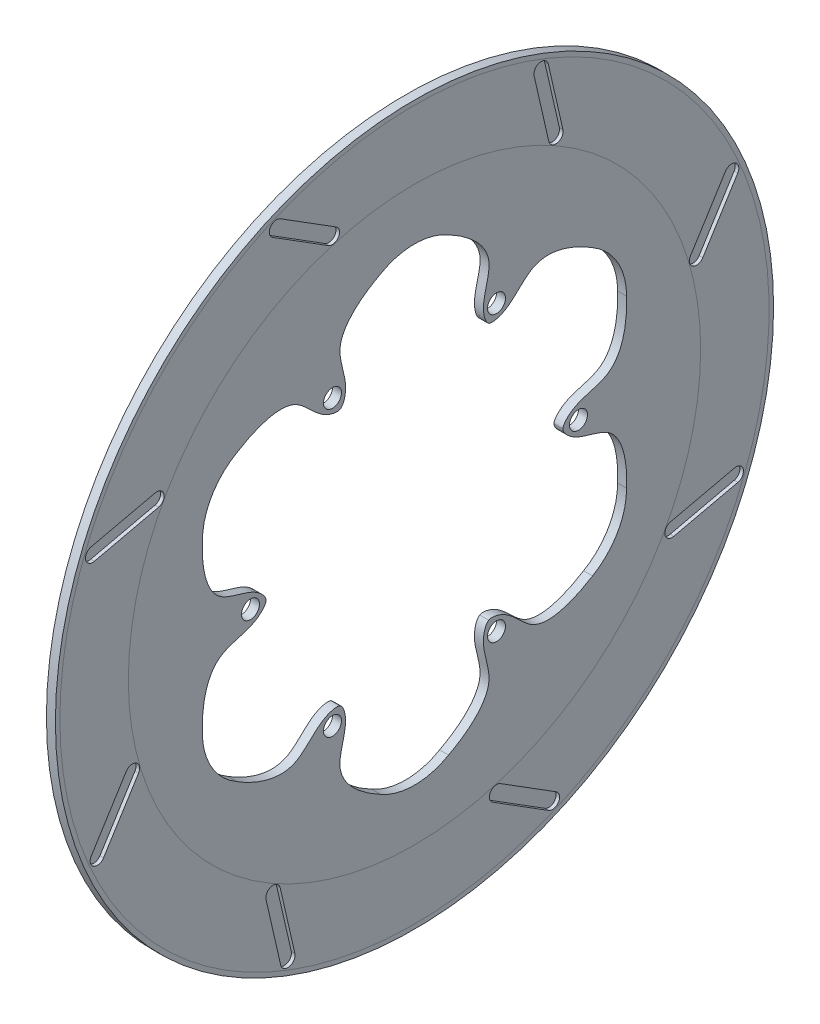
from build123d import *

# Parameters (mm, degrees)
SKETCH1_R                = 127
SKETCH1_R_2              = 3.175
SKETCH1_R_3              = 52.5
BOSS_EXTRUDE1_DEPTH      = 3.175
CUT_EXTRUDE7_DEPTH       = 1.27
CUT_EXTRUDE9_DEPTH       = 1.27
SKETCH31_RX              = 23.014926529
SKETCH31_RY              = 21.216885394
CUT_EXTRUDE10_DEPTH      = 205.994
CUT_EXTRUDE11_DEPTH      = 121.92
CUT_EXTRUDE11_DEPTH_BACK = 7.112
CUT_EXTRUDE13_START      = -3.175
CUT_EXTRUDE13_DEPTH      = 3.175


# Read off the part's stored shape, not the designer's step: Cut-Extrude13
with BuildPart() as part:
    # Sketch1 → Boss-Extrude1 (new body)
    with BuildSketch(Plane.ZY):
        Circle(SKETCH1_R)
        with Locations((29, 50.229473419)):
            Circle(SKETCH1_R_2, mode=Mode.SUBTRACT)
        with Locations((-58, 0)):
            Circle(SKETCH1_R_2, mode=Mode.SUBTRACT)
        with Locations((58, 0)):
            Circle(SKETCH1_R_2, mode=Mode.SUBTRACT)
        with Locations((-29, -50.229473419)):
            Circle(SKETCH1_R_2, mode=Mode.SUBTRACT)
        with Locations((29, -50.229473419)):
            Circle(SKETCH1_R_2, mode=Mode.SUBTRACT)
        with Locations((-29, 50.229473419)):
            Circle(SKETCH1_R_2, mode=Mode.SUBTRACT)
        Circle(SKETCH1_R_3, mode=Mode.SUBTRACT)
    extrude(amount=BOSS_EXTRUDE1_DEPTH)

    # Sketch28 → Cut-Extrude7 (cut)
    with BuildSketch(Plane.ZY.offset(3.175)):
        with BuildLine():
            Line((68.660394365, 80.255233954), (91.914044035, 82.885177581))
            ThreePointArc((91.914044035, 82.885177581), (94.755506117, 80.621138038), (92.491466575, 77.779675956))
            Line((92.491466575, 77.779675956), (69.237816905, 75.14973233))
            ThreePointArc((69.237816905, 75.14973233), (66.396354823, 77.413771872), (68.660394365, 80.255233954))
        make_face()
        with BuildLine():
            Line((-8.1987897, 105.299250609), (6.384372696, 123.60171495))
            ThreePointArc((6.384372696, 123.60171495), (9.994507516, 124.010014344), (10.40280691, 120.399879524))
            Line((10.40280691, 120.399879524), (-4.180355487, 102.097415183))
            ThreePointArc((-4.180355487, 102.097415183), (-7.790490307, 101.689115789), (-8.1987897, 105.299250609))
        make_face()
        with BuildLine():
            Line((105.299250609, 8.1987897), (123.60171495, -6.384372696))
            ThreePointArc((123.60171495, -6.384372696), (124.010014344, -9.994507516), (120.399879524, -10.40280691))
            Line((120.399879524, -10.40280691), (102.097415183, 4.180355487))
            ThreePointArc((102.097415183, 4.180355487), (101.689115789, 7.790490307), (105.299250609, 8.1987897))
        make_face()
        with BuildLine():
            Line((80.255233954, -68.660394365), (82.885177581, -91.914044035))
            ThreePointArc((82.885177581, -91.914044035), (80.621138038, -94.755506117), (77.779675956, -92.491466575))
            Line((77.779675956, -92.491466575), (75.14973233, -69.237816905))
            ThreePointArc((75.14973233, -69.237816905), (77.413771872, -66.396354823), (80.255233954, -68.660394365))
        make_face()
        with BuildLine():
            Line((8.1987897, -105.299250609), (-6.384372696, -123.60171495))
            ThreePointArc((-6.384372696, -123.60171495), (-9.994507516, -124.010014344), (-10.40280691, -120.399879524))
            Line((-10.40280691, -120.399879524), (4.180355487, -102.097415183))
            ThreePointArc((4.180355487, -102.097415183), (7.790490307, -101.689115789), (8.1987897, -105.299250609))
        make_face()
        with BuildLine():
            Line((-68.660394365, -80.255233954), (-91.914044035, -82.885177581))
            ThreePointArc((-91.914044035, -82.885177581), (-94.755506117, -80.621138038), (-92.491466575, -77.779675956))
            Line((-92.491466575, -77.779675956), (-69.237816905, -75.14973233))
            ThreePointArc((-69.237816905, -75.14973233), (-66.396354823, -77.413771872), (-68.660394365, -80.255233954))
        make_face()
        with BuildLine():
            Line((-105.299250609, -8.1987897), (-123.60171495, 6.384372696))
            ThreePointArc((-123.60171495, 6.384372696), (-124.010014344, 9.994507516), (-120.399879524, 10.40280691))
            Line((-120.399879524, 10.40280691), (-102.097415183, -4.180355487))
            ThreePointArc((-102.097415183, -4.180355487), (-101.689115789, -7.790490307), (-105.299250609, -8.1987897))
        make_face()
        with BuildLine():
            Line((-80.255233954, 68.660394365), (-82.885177581, 91.914044035))
            ThreePointArc((-82.885177581, 91.914044035), (-80.621138038, 94.755506117), (-77.779675956, 92.491466575))
            Line((-77.779675956, 92.491466575), (-75.14973233, 69.237816905))
            ThreePointArc((-75.14973233, 69.237816905), (-77.413771872, 66.396354823), (-80.255233954, 68.660394365))
        make_face()
    extrude(amount=-CUT_EXTRUDE7_DEPTH, mode=Mode.SUBTRACT)

    # Sketch30 → Cut-Extrude9 (cut)
    with BuildSketch(Plane(origin=(0, 0, 0), x_dir=(0, 0, -1), z_dir=(1, 0, 0))):
        with BuildLine():
            Line((52.499778397, 91.665844493), (47.303844486, 114.363287974))
            ThreePointArc((47.303844486, 114.363287974), (44.232592049, 116.290324387), (42.305555635, 113.21907195))
            Line((42.305555635, 113.21907195), (47.501489546, 90.521628469))
            ThreePointArc((47.501489546, 90.521628469), (50.572741983, 88.594592056), (52.499778397, 91.665844493))
        make_face()
        with BuildLine():
            Line((101.940489559, 27.694590929), (114.315925657, 47.418187233))
            ThreePointArc((114.315925657, 47.418187233), (113.506842748, 50.952511174), (109.972518807, 50.143428264))
            Line((109.972518807, 50.143428264), (97.597082709, 30.41983196))
            ThreePointArc((97.597082709, 30.41983196), (98.406165619, 26.885508019), (101.940489559, 27.694590929))
        make_face()
        with BuildLine():
            Line((91.665844493, -52.499778397), (114.363287974, -47.303844486))
            ThreePointArc((114.363287974, -47.303844486), (116.290324387, -44.232592049), (113.21907195, -42.305555635))
            Line((113.21907195, -42.305555635), (90.521628469, -47.501489546))
            ThreePointArc((90.521628469, -47.501489546), (88.594592056, -50.572741983), (91.665844493, -52.499778397))
        make_face()
        with BuildLine():
            Line((27.694590929, -101.940489559), (47.418187233, -114.315925657))
            ThreePointArc((47.418187233, -114.315925657), (50.952511174, -113.506842748), (50.143428264, -109.972518807))
            Line((50.143428264, -109.972518807), (30.41983196, -97.597082709))
            ThreePointArc((30.41983196, -97.597082709), (26.885508019, -98.406165619), (27.694590929, -101.940489559))
        make_face()
        with BuildLine():
            Line((-52.499778397, -91.665844493), (-47.303844486, -114.363287974))
            ThreePointArc((-47.303844486, -114.363287974), (-44.232592049, -116.290324387), (-42.305555635, -113.21907195))
            Line((-42.305555635, -113.21907195), (-47.501489546, -90.521628469))
            ThreePointArc((-47.501489546, -90.521628469), (-50.572741983, -88.594592056), (-52.499778397, -91.665844493))
        make_face()
        with BuildLine():
            Line((-101.940489559, -27.694590929), (-114.315925657, -47.418187233))
            ThreePointArc((-114.315925657, -47.418187233), (-113.506842748, -50.952511174), (-109.972518807, -50.143428264))
            Line((-109.972518807, -50.143428264), (-97.597082709, -30.41983196))
            ThreePointArc((-97.597082709, -30.41983196), (-98.406165619, -26.885508019), (-101.940489559, -27.694590929))
        make_face()
        with BuildLine():
            Line((-91.665844493, 52.499778397), (-114.363287974, 47.303844486))
            ThreePointArc((-114.363287974, 47.303844486), (-116.290324387, 44.232592049), (-113.21907195, 42.305555635))
            Line((-113.21907195, 42.305555635), (-90.521628469, 47.501489546))
            ThreePointArc((-90.521628469, 47.501489546), (-88.594592056, 50.572741983), (-91.665844493, 52.499778397))
        make_face()
        with BuildLine():
            Line((-27.694590929, 101.940489559), (-47.418187233, 114.315925657))
            ThreePointArc((-47.418187233, 114.315925657), (-50.952511174, 113.506842748), (-50.143428264, 109.972518807))
            Line((-50.143428264, 109.972518807), (-30.41983196, 97.597082709))
            ThreePointArc((-30.41983196, 97.597082709), (-26.885508019, 98.406165619), (-27.694590929, 101.940489559))
        make_face()
    extrude(amount=-CUT_EXTRUDE9_DEPTH, mode=Mode.SUBTRACT)

    # Sketch31 → Cut-Extrude10 (cut)
    with BuildSketch(Plane.ZY.offset(3.175)):
        with Locations((0, 55.9190793)):
            Ellipse(SKETCH31_RX, SKETCH31_RY)
        with Locations(Location((48.42734323, 27.95953965), (0, 0, -60))):
            Ellipse(SKETCH31_RX, SKETCH31_RY)
        with Locations(Location((48.42734323, -27.95953965), (0, 0, 60))):
            Ellipse(SKETCH31_RX, SKETCH31_RY)
        with Locations(Location((0, -55.9190793), (0, 0, 180))):
            Ellipse(SKETCH31_RX, SKETCH31_RY)
        with Locations(Location((-48.42734323, -27.95953965), (0, 0, -60))):
            Ellipse(SKETCH31_RX, SKETCH31_RY)
        with Locations(Location((-48.42734323, 27.95953965), (0, 0, -120))):
            Ellipse(SKETCH31_RX, SKETCH31_RY)
    extrude(amount=-CUT_EXTRUDE10_DEPTH, mode=Mode.SUBTRACT)

    # Sketch33 → Cut-Extrude11 (cut, two sides: drawn at the far end of the back side and taken through both)
    with BuildSketch(Plane(origin=(0, 0, 0), x_dir=(0, 0, -1), z_dir=(1, 0, 0)).offset(-CUT_EXTRUDE11_DEPTH_BACK)):
        with BuildLine():
            Line((24.09375121, 58.795945116), (24.09375121, 46.131010291))
            ThreePointArc((24.09375121, 46.131010291), (25.36375121, 43.931305766), (27.90375121, 43.931305766))
            Line((27.90375121, 43.931305766), (38.871906505, 50.263773178))
            ThreePointArc((38.871906505, 50.263773178), (71.78458273, 41.444848163), (62.965657715, 8.532171938))
            Line((62.965657715, 8.532171938), (51.99750242, 2.199704526))
            ThreePointArc((51.99750242, 2.199704526), (50.72750242, 0), (51.99750242, -2.199704526))
            Line((51.99750242, -2.199704526), (62.965657715, -8.532171938))
            ThreePointArc((62.965657715, -8.532171938), (71.78458273, -41.444848163), (38.871906505, -50.263773178))
            Line((38.871906505, -50.263773178), (27.90375121, -43.931305766))
            ThreePointArc((27.90375121, -43.931305766), (25.36375121, -43.931305766), (24.09375121, -46.131010291))
            Line((24.09375121, -46.131010291), (24.09375121, -58.795945116))
            ThreePointArc((24.09375121, -58.795945116), (0, -82.889696326), (-24.09375121, -58.795945116))
            Line((-24.09375121, -58.795945116), (-24.09375121, -46.131010291))
            ThreePointArc((-24.09375121, -46.131010291), (-25.36375121, -43.931305766), (-27.90375121, -43.931305766))
            Line((-27.90375121, -43.931305766), (-38.871906505, -50.263773178))
            ThreePointArc((-38.871906505, -50.263773178), (-71.78458273, -41.444848163), (-62.965657715, -8.532171938))
            Line((-62.965657715, -8.532171938), (-51.99750242, -2.199704526))
            ThreePointArc((-51.99750242, -2.199704526), (-50.72750242, 0), (-51.99750242, 2.199704526))
            Line((-51.99750242, 2.199704526), (-62.965657715, 8.532171938))
            ThreePointArc((-62.965657715, 8.532171938), (-71.78458273, 41.444848163), (-38.871906505, 50.263773178))
            Line((-38.871906505, 50.263773178), (-27.90375121, 43.931305766))
            ThreePointArc((-27.90375121, 43.931305766), (-25.36375121, 43.931305766), (-24.09375121, 46.131010291))
            Line((-24.09375121, 46.131010291), (-24.09375121, 58.795945116))
            ThreePointArc((-24.09375121, 58.795945116), (0, 82.889696326), (24.09375121, 58.795945116))
        make_face()
    extrude(amount=CUT_EXTRUDE11_DEPTH + CUT_EXTRUDE11_DEPTH_BACK, mode=Mode.SUBTRACT)

    # Cut-Extrude13 outline → Cut-Extrude13 (cut)
    with BuildSketch(Plane.ZY.offset(3.175).offset(CUT_EXTRUDE13_START)):
        with BuildLine():
            ThreePointArc((52.442492502, 2.456619669), (52.485410124, 1.237628414), (52.499996925, 0.017969105))
            add(Edge.make_bspline(
                [(52.499996925, 0.017969105), (52.503324793, 0.790931655), (56.579618969, 6.695556257), (73.025329433, 5.856601543), (75.323175508, 21.981339228), (75.01253332, 29.397972558)],
                knots=[0.500148642, 0.500148642, 0.500148642, 0.500148642, 0.523668468, 0.679925184, 0.880818394, 0.880818394, 0.880818394, 0.880818394], degree=3))
            ThreePointArc((75.01253332, 29.397972558), (71.78458273, 17.351096953), (62.965657715, 8.532171938))
            Line((62.965657715, 8.532171938), (52.442492502, 2.456619669))
        make_face()
        with BuildLine():
            add(Edge.make_bspline(
                [(75.01253332, -29.397972558), (75.318575124, -21.98362074), (73.030749267, -5.84420335), (56.579320165, -6.67773218), (52.503631463, -0.77022758), (52.499999928, 0.002758046)],
                knots=[0.119181218, 0.119181218, 0.119181218, 0.119181218, 0.320185932, 0.476473879, 0.49999436, 0.49999436, 0.49999436, 0.49999436], degree=3))
            ThreePointArc((52.499999928, 0.002758046), (52.485653411, -1.227267694), (52.442492502, -2.456619669))
            Line((52.442492502, -2.456619669), (62.965657715, -8.532171938))
            ThreePointArc((62.965657715, -8.532171938), (71.78458273, -17.351096953), (75.01253332, -29.397972558))
        make_face()
        with BuildLine():
            ThreePointArc((38.871906505, 50.263773178), (50.91878211, 53.491723768), (62.965657715, 50.263773178))
            add(Edge.make_bspline(
                [(62.965657715, 50.263773178), (56.69766159, 54.235989064), (41.576603199, 60.324382447), (34.07274579, 45.660262502), (26.918852383, 45.084364848), (26.247611426, 45.467712659)],
                knots=[0.119181218, 0.119181218, 0.119181218, 0.119181218, 0.320185932, 0.476473879, 0.49999436, 0.49999436, 0.49999436, 0.49999436], degree=3))
            ThreePointArc((26.247611426, 45.467712659), (27.305671706, 44.840275342), (28.348741292, 44.18822091))
            Line((28.348741292, 44.18822091), (38.871906505, 50.263773178))
        make_face()
        with BuildLine():
            add(Edge.make_bspline(
                [(26.265560164, -45.457346483), (26.936629302, -45.073747226), (34.088331295, -45.651609235), (41.584630432, -60.313489638), (56.697985935, -54.24111387), (62.965657715, -50.263773178)],
                knots=[0.500148642, 0.500148642, 0.500148642, 0.500148642, 0.523668468, 0.679925184, 0.880818394, 0.880818394, 0.880818394, 0.880818394], degree=3))
            ThreePointArc((62.965657715, -50.263773178), (50.91878211, -53.491723768), (38.871906505, -50.263773178))
            Line((38.871906505, -50.263773178), (28.348741292, -44.18822091))
            ThreePointArc((28.348741292, -44.18822091), (27.314522709, -44.834884289), (26.265560164, -45.457346483))
        make_face()
        with BuildLine():
            ThreePointArc((24.09375121, 46.644840579), (25.170887416, 46.072512702), (26.234436762, 45.475315588))
            add(Edge.make_bspline(
                [(26.234436762, 45.475315588), (25.566695491, 45.86467888), (22.491287673, 52.347165492), (31.440699001, 66.17009118), (18.625189573, 76.222453098), (12.046875605, 79.661745737)],
                knots=[0.500148642, 0.500148642, 0.500148642, 0.500148642, 0.523668468, 0.679925184, 0.880818394, 0.880818394, 0.880818394, 0.880818394], degree=3))
            ThreePointArc((12.046875605, 79.661745737), (20.86580062, 70.842820721), (24.09375121, 58.795945116))
            Line((24.09375121, 58.795945116), (24.09375121, 46.644840579))
        make_face()
        with BuildLine():
            add(Edge.make_bspline(
                [(12.046875605, -79.661745737), (18.620913534, -76.219609804), (31.454146067, -66.168585797), (22.506574375, -52.337994682), (25.584779081, -45.854592428), (26.252388502, -45.464954613)],
                knots=[0.119181218, 0.119181218, 0.119181218, 0.119181218, 0.320185932, 0.476473879, 0.49999436, 0.49999436, 0.49999436, 0.49999436], degree=3))
            ThreePointArc((26.252388502, -45.464954613), (25.179981706, -46.067543035), (24.09375121, -46.644840579))
            Line((24.09375121, -46.644840579), (24.09375121, -58.795945116))
            ThreePointArc((24.09375121, -58.795945116), (20.86580062, -70.842820721), (12.046875605, -79.661745737))
        make_face()
        with BuildLine():
            ThreePointArc((-24.09375121, 58.795945116), (-20.86580062, 70.842820721), (-12.046875605, 79.661745736))
            add(Edge.make_bspline(
                [(-12.046875605, 79.661745736), (-18.620913534, 76.219609804), (-31.454146067, 66.168585797), (-22.506574375, 52.337994682), (-25.584779081, 45.854592428), (-26.252388502, 45.464954613)],
                knots=[0.119181218, 0.119181218, 0.119181218, 0.119181218, 0.320185932, 0.476473879, 0.49999436, 0.49999436, 0.49999436, 0.49999436], degree=3))
            ThreePointArc((-26.252388502, 45.464954613), (-25.179981706, 46.067543035), (-24.09375121, 46.644840579))
            Line((-24.09375121, 46.644840579), (-24.09375121, 58.795945116))
        make_face()
        with BuildLine():
            add(Edge.make_bspline(
                [(-26.234436761, -45.475315588), (-25.566695491, -45.86467888), (-22.491287673, -52.347165492), (-31.440699001, -66.17009118), (-18.625189573, -76.222453098), (-12.046875605, -79.661745737)],
                knots=[0.500148642, 0.500148642, 0.500148642, 0.500148642, 0.523668468, 0.679925184, 0.880818394, 0.880818394, 0.880818394, 0.880818394], degree=3))
            ThreePointArc((-12.046875605, -79.661745737), (-20.86580062, -70.842820721), (-24.09375121, -58.795945116))
            Line((-24.09375121, -58.795945116), (-24.09375121, -46.644840579))
            ThreePointArc((-24.09375121, -46.644840579), (-25.170887416, -46.072512702), (-26.234436761, -45.475315588))
        make_face()
        with BuildLine():
            ThreePointArc((-28.348741292, 44.18822091), (-27.314522709, 44.834884289), (-26.265560164, 45.457346483))
            add(Edge.make_bspline(
                [(-26.265560164, 45.457346483), (-26.936629302, 45.073747226), (-34.088331295, 45.651609235), (-41.584630432, 60.313489638), (-56.697985935, 54.24111387), (-62.965657715, 50.263773178)],
                knots=[0.500148642, 0.500148642, 0.500148642, 0.500148642, 0.523668468, 0.679925184, 0.880818394, 0.880818394, 0.880818394, 0.880818394], degree=3))
            ThreePointArc((-62.965657715, 50.263773178), (-50.91878211, 53.491723768), (-38.871906505, 50.263773178))
            Line((-38.871906505, 50.263773178), (-28.348741292, 44.18822091))
        make_face()
        with BuildLine():
            add(Edge.make_bspline(
                [(-62.965657715, -50.263773178), (-56.69766159, -54.235989064), (-41.576603199, -60.324382447), (-34.07274579, -45.660262502), (-26.918852383, -45.084364848), (-26.247611426, -45.467712659)],
                knots=[0.119181218, 0.119181218, 0.119181218, 0.119181218, 0.320185932, 0.476473879, 0.49999436, 0.49999436, 0.49999436, 0.49999436], degree=3))
            ThreePointArc((-26.247611426, -45.467712659), (-27.305671706, -44.840275342), (-28.348741292, -44.18822091))
            Line((-28.348741292, -44.18822091), (-38.871906505, -50.263773178))
            ThreePointArc((-38.871906505, -50.263773178), (-50.91878211, -53.491723768), (-62.965657715, -50.263773178))
        make_face()
        with BuildLine():
            ThreePointArc((-62.965657715, 8.532171938), (-71.78458273, 17.351096953), (-75.01253332, 29.397972558))
            add(Edge.make_bspline(
                [(-75.01253332, 29.397972558), (-75.318575124, 21.98362074), (-73.030749267, 5.84420335), (-56.579320165, 6.67773218), (-52.503631463, 0.770227579), (-52.499999928, -0.002758047)],
                knots=[0.119181218, 0.119181218, 0.119181218, 0.119181218, 0.320185932, 0.476473879, 0.49999436, 0.49999436, 0.49999436, 0.49999436], degree=3))
            ThreePointArc((-52.499999928, -0.002758047), (-52.485653411, 1.227267693), (-52.442492502, 2.456619669))
            Line((-52.442492502, 2.456619669), (-62.965657715, 8.532171938))
        make_face()
        with BuildLine():
            add(Edge.make_bspline(
                [(-52.499996925, -0.017969105), (-52.503324793, -0.790931655), (-56.579618969, -6.695556257), (-73.025329433, -5.856601543), (-75.323175508, -21.981339228), (-75.01253332, -29.397972558)],
                knots=[0.500148642, 0.500148642, 0.500148642, 0.500148642, 0.523668468, 0.679925184, 0.880818394, 0.880818394, 0.880818394, 0.880818394], degree=3))
            ThreePointArc((-75.01253332, -29.397972558), (-71.78458273, -17.351096953), (-62.965657715, -8.532171938))
            Line((-62.965657715, -8.532171938), (-52.442492502, -2.456619669))
            ThreePointArc((-52.442492502, -2.456619669), (-52.485410124, -1.237628414), (-52.499996925, -0.017969105))
        make_face()
    extrude(amount=CUT_EXTRUDE13_DEPTH, mode=Mode.SUBTRACT)


solid = part.part
